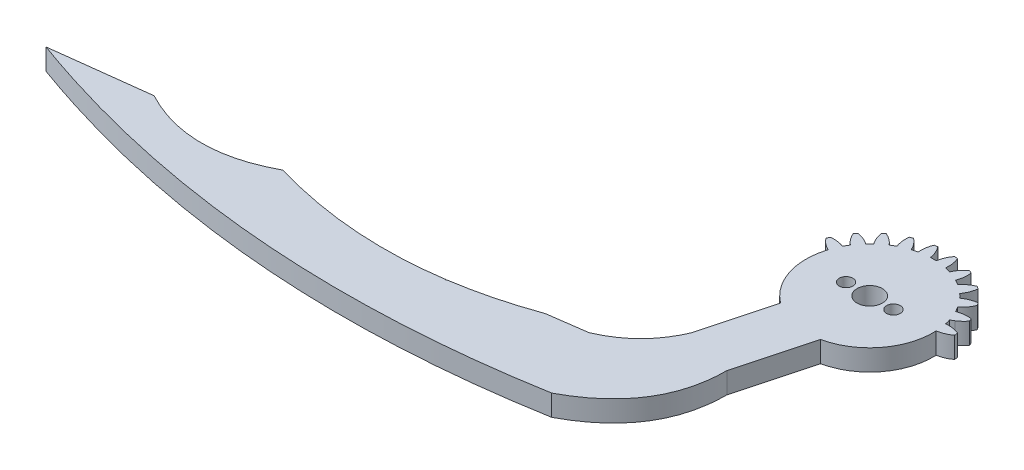
from build123d import *
from build123d.topology import SkipClean

# Parameters (mm, degrees)
SKETCH1_R           = 1.5
BOSS_EXTRUDE1_DEPTH = 4
SKETCH3_R           = 1.75
BOSS_EXTRUDE2_DEPTH = 4
CUT_EXTRUDE1_START  = -4
CUT_EXTRUDE1_DEPTH  = 4
CUT_EXTRUDE2_REACH  = 49.073
SKETCH5_R           = 1.3
SKETCH5_R_2         = 2.4
BOSS_EXTRUDE3_START = -4
BOSS_EXTRUDE3_DEPTH = 4
CUT_EXTRUDE3_START  = -10
SKETCH6_3_R         = 1.75
CUT_EXTRUDE3_DEPTH  = 10


with BuildPart() as part:
    # Sketch1 → Boss-Extrude1 (new body)
    with BuildSketch(Plane(origin=(0, 0, 0), x_dir=(1, 0, 0), z_dir=(0, 1, 0))):
        with BuildLine():
            Line((20.643657446, 4), (2.081641936, 4))
            ThreePointArc((2.081641936, 4), (2.861028333, 4.588201733), (3.521749436, 5.30713988))
            ThreePointArc((3.521749436, 5.30713988), (3.405395609, 5.596745198), (3.282888305, 5.883801663))
            ThreePointArc((3.282888305, 5.883801663), (1.93527598, 5.894040025), (0.627094961, 5.57027124))
            ThreePointArc((0.627094961, 5.57027124), (0.366286148, 6.046375), (0.084372603, 6.510293938))
            ThreePointArc((0.084372603, 6.510293938), (1.018855105, 7.48132754), (1.683794586, 8.65351323))
            ThreePointArc((1.683794586, 8.65351323), (1.496450048, 8.903135899), (1.303821399, 9.148703928))
            ThreePointArc((1.303821399, 9.148703928), (-0.000522033, 8.809805691), (-1.180330337, 8.158486898))
            ThreePointArc((-1.180330337, 8.158486898), (-1.555477026, 8.550865528), (-1.947855656, 8.926012217))
            ThreePointArc((-1.947855656, 8.926012217), (-1.296536862, 10.105820521), (-0.957638625, 11.410163953))
            ThreePointArc((-0.957638625, 11.410163953), (-1.203206655, 11.602792602), (-1.452829324, 11.79013714))
            ThreePointArc((-1.452829324, 11.79013714), (-2.625015014, 11.125197659), (-3.596048616, 10.190715157))
            ThreePointArc((-3.596048616, 10.190715157), (-4.059967554, 10.472628702), (-4.536071314, 10.733437515))
            ThreePointArc((-4.536071314, 10.733437515), (-4.212302529, 12.041618533), (-4.222540891, 13.389230859))
            ThreePointArc((-4.222540891, 13.389230859), (-4.509597355, 13.511738163), (-4.799202674, 13.62809199))
            ThreePointArc((-4.799202674, 13.62809199), (-5.759348103, 12.682425791), (-6.455432668, 11.528463019))
            ThreePointArc((-6.455432668, 11.528463019), (-6.976508546, 11.680699536), (-7.503891752, 11.809396783))
            ThreePointArc((-7.503891752, 11.809396783), (-7.529737283, 13.156800143), (-7.888414517, 14.455843809))
            ThreePointArc((-7.888414517, 14.455843809), (-8.197396993, 14.499881098), (-8.507248835, 14.537314892))
            ThreePointArc((-8.507248835, 14.537314892), (-9.18992168, 13.375367565), (-9.563620196, 12.080565177))
            ThreePointArc((-9.563620196, 12.080565177), (-10.106342554, 12.09275), (-10.649064912, 12.080565177))
            ThreePointArc((-10.649064912, 12.080565177), (-11.022763428, 13.375367565), (-11.705436272, 14.537314892))
            ThreePointArc((-11.705436272, 14.537314892), (-12.015288115, 14.499881098), (-12.324270591, 14.455843809))
            ThreePointArc((-12.324270591, 14.455843809), (-12.682947825, 13.156800143), (-12.708793355, 11.809396783))
            ThreePointArc((-12.708793355, 11.809396783), (-13.236176561, 11.680699536), (-13.757252439, 11.528463019))
            ThreePointArc((-13.757252439, 11.528463019), (-14.453337005, 12.682425791), (-15.413482434, 13.62809199))
            ThreePointArc((-15.413482434, 13.62809199), (-15.703087752, 13.511738163), (-15.990144217, 13.389230859))
            ThreePointArc((-15.990144217, 13.389230859), (-16.000382579, 12.041618533), (-15.676613793, 10.733437515))
            ThreePointArc((-15.676613793, 10.733437515), (-16.152717554, 10.472628702), (-16.616636492, 10.190715157))
            ThreePointArc((-16.616636492, 10.190715157), (-17.587670094, 11.125197659), (-18.759855783, 11.79013714))
            ThreePointArc((-18.759855783, 11.79013714), (-19.009478453, 11.602792602), (-19.255046482, 11.410163953))
            ThreePointArc((-19.255046482, 11.410163953), (-18.916148245, 10.105820521), (-18.264829452, 8.926012217))
            ThreePointArc((-18.264829452, 8.926012217), (-18.657208082, 8.550865528), (-19.032354771, 8.158486898))
            ThreePointArc((-19.032354771, 8.158486898), (-20.212163074, 8.809805691), (-21.516506507, 9.148703928))
            ThreePointArc((-21.516506507, 9.148703928), (-21.709135156, 8.903135899), (-21.896479694, 8.65351323))
            ThreePointArc((-21.896479694, 8.65351323), (-21.231540213, 7.48132754), (-20.297057711, 6.510293938))
            ThreePointArc((-20.297057711, 6.510293938), (-20.578971255, 6.046375), (-20.839780068, 5.57027124))
            ThreePointArc((-20.839780068, 5.57027124), (-22.147961087, 5.894040025), (-23.495573413, 5.883801663))
            ThreePointArc((-23.495573413, 5.883801663), (-23.618080717, 5.596745198), (-23.734434544, 5.30713988))
            ThreePointArc((-23.734434544, 5.30713988), (-22.788768345, 4.346994451), (-21.634805572, 3.650909885))
            ThreePointArc((-21.634805572, 3.650909885), (-21.78704209, 3.129834008), (-21.915739337, 2.602450802))
            ThreePointArc((-21.915739337, 2.602450802), (-23.263142697, 2.576605271), (-24.562186363, 2.217928037))
            ThreePointArc((-24.562186363, 2.217928037), (-24.606223651, 1.908945561), (-24.643657446, 1.599093719))
            ThreePointArc((-24.643657446, 1.599093719), (-23.481710119, 0.916420874), (-22.186907731, 0.542722358))
            ThreePointArc((-22.186907731, 0.542722358), (-22.199092554, 0), (-22.186907731, -0.542722358))
            ThreePointArc((-22.186907731, -0.542722358), (-23.481710119, -0.916420874), (-24.643657446, -1.599093719))
            ThreePointArc((-24.643657446, -1.599093719), (-24.606223651, -1.908945561), (-24.562186363, -2.217928037))
            ThreePointArc((-24.562186363, -2.217928037), (-23.263142697, -2.576605271), (-21.915739337, -2.602450802))
            ThreePointArc((-21.915739337, -2.602450802), (-21.78704209, -3.129834008), (-21.634805572, -3.650909885))
            ThreePointArc((-21.634805572, -3.650909885), (-22.788768345, -4.346994451), (-23.734434544, -5.30713988))
            ThreePointArc((-23.734434544, -5.30713988), (-23.618080717, -5.596745198), (-23.495573413, -5.883801663))
            ThreePointArc((-23.495573413, -5.883801663), (-22.147961087, -5.894040025), (-20.839780068, -5.57027124))
            ThreePointArc((-20.839780068, -5.57027124), (-20.578971255, -6.046375), (-20.297057711, -6.510293938))
            ThreePointArc((-20.297057711, -6.510293938), (-21.231540213, -7.48132754), (-21.896479694, -8.65351323))
            ThreePointArc((-21.896479694, -8.65351323), (-21.709135156, -8.903135899), (-21.516506507, -9.148703928))
            ThreePointArc((-21.516506507, -9.148703928), (-20.212163074, -8.809805691), (-19.032354771, -8.158486898))
            ThreePointArc((-19.032354771, -8.158486898), (-18.657208082, -8.550865528), (-18.264829452, -8.926012217))
            ThreePointArc((-18.264829452, -8.926012217), (-18.916148245, -10.105820521), (-19.255046482, -11.410163953))
            ThreePointArc((-19.255046482, -11.410163953), (-19.009478453, -11.602792602), (-18.759855783, -11.79013714))
            ThreePointArc((-18.759855783, -11.79013714), (-17.587670094, -11.125197659), (-16.616636492, -10.190715157))
            ThreePointArc((-16.616636492, -10.190715157), (-16.152717554, -10.472628702), (-15.676613793, -10.733437515))
            ThreePointArc((-15.676613793, -10.733437515), (-16.000382579, -12.041618533), (-15.990144217, -13.389230859))
            ThreePointArc((-15.990144217, -13.389230859), (-15.703087752, -13.511738163), (-15.413482434, -13.62809199))
            ThreePointArc((-15.413482434, -13.62809199), (-14.453337005, -12.682425791), (-13.757252439, -11.528463019))
            ThreePointArc((-13.757252439, -11.528463019), (-13.236176561, -11.680699536), (-12.708793355, -11.809396783))
            ThreePointArc((-12.708793355, -11.809396783), (-12.682947825, -13.156800143), (-12.324270591, -14.455843809))
            ThreePointArc((-12.324270591, -14.455843809), (-12.015288115, -14.499881098), (-11.705436272, -14.537314892))
            ThreePointArc((-11.705436272, -14.537314892), (-11.022763428, -13.375367565), (-10.649064912, -12.080565177))
            ThreePointArc((-10.649064912, -12.080565177), (-10.106342554, -12.09275), (-9.563620196, -12.080565177))
            ThreePointArc((-9.563620196, -12.080565177), (-9.18992168, -13.375367565), (-8.507248835, -14.537314892))
            ThreePointArc((-8.507248835, -14.537314892), (-8.197396993, -14.499881098), (-7.888414517, -14.455843809))
            ThreePointArc((-7.888414517, -14.455843809), (-7.529737283, -13.156800143), (-7.503891752, -11.809396783))
            ThreePointArc((-7.503891752, -11.809396783), (-6.976508546, -11.680699536), (-6.455432668, -11.528463019))
            ThreePointArc((-6.455432668, -11.528463019), (-5.759348103, -12.682425791), (-4.799202674, -13.62809199))
            ThreePointArc((-4.799202674, -13.62809199), (-4.509597355, -13.511738163), (-4.222540891, -13.389230859))
            ThreePointArc((-4.222540891, -13.389230859), (-4.212302529, -12.041618533), (-4.536071314, -10.733437515))
            ThreePointArc((-4.536071314, -10.733437515), (-4.059967554, -10.472628702), (-3.596048616, -10.190715157))
            ThreePointArc((-3.596048616, -10.190715157), (-2.625015014, -11.125197659), (-1.452829324, -11.79013714))
            ThreePointArc((-1.452829324, -11.79013714), (-1.203206655, -11.602792602), (-0.957638625, -11.410163953))
            ThreePointArc((-0.957638625, -11.410163953), (-1.296536862, -10.105820521), (-1.947855656, -8.926012217))
            ThreePointArc((-1.947855656, -8.926012217), (-1.555477026, -8.550865528), (-1.180330337, -8.158486898))
            ThreePointArc((-1.180330337, -8.158486898), (-0.000522033, -8.809805691), (1.303821399, -9.148703928))
            ThreePointArc((1.303821399, -9.148703928), (1.496450048, -8.903135899), (1.683794586, -8.65351323))
            ThreePointArc((1.683794586, -8.65351323), (1.018855105, -7.48132754), (0.084372603, -6.510293938))
            ThreePointArc((0.084372603, -6.510293938), (0.366286148, -6.046375), (0.627094961, -5.57027124))
            ThreePointArc((0.627094961, -5.57027124), (1.93527598, -5.894040025), (3.282888305, -5.883801663))
            ThreePointArc((3.282888305, -5.883801663), (3.405395609, -5.596745198), (3.521749436, -5.30713988))
            ThreePointArc((3.521749436, -5.30713988), (2.861028333, -4.588201733), (2.081641936, -4))
            Line((2.081641936, -4), (20.643657446, -4))
            ThreePointArc((20.643657446, -4), (24.643657446, 0), (20.643657446, 4))
        make_face()
        with Locations(Location((-10.106342554, 0, 0), (0, 0, 270))):
            Circle(SKETCH1_R, mode=Mode.SUBTRACT)
        with Locations(Location((20.643657446, 0, 0), (0, 0, 270))):
            Circle(SKETCH1_R, mode=Mode.SUBTRACT)
    extrude(amount=BOSS_EXTRUDE1_DEPTH)

    # Sketch3 → Boss-Extrude2 (add)
    with BuildSketch(Plane(origin=(0, 4, 0), x_dir=(1, 0, 0), z_dir=(0, 1, 0))):
        with BuildLine():
            ThreePointArc((-9.584237785, -3.965779445), (-14.072121999, -0.522104769), (-10.628447323, 3.965779445))
            Line((-10.628447323, 3.965779445), (-41.11537681, -0.047900965))
            ThreePointArc((-41.11537681, -0.047900965), (-44.559051487, -4.53578518), (-40.071167272, -7.979459856))
            Line((-40.071167272, -7.979459856), (-9.584237785, -3.965779445))
        make_face()
        with Locations(Location((-40.593272041, -4.013680411, 0), (0, 0, 270))):
            Circle(SKETCH3_R, mode=Mode.SUBTRACT)
    extrude(amount=-BOSS_EXTRUDE2_DEPTH)

    # Sketch4 → Cut-Extrude1 (cut)
    with SkipClean():  # the faces are left unmerged after this step: merging them gives an invalid solid
        with BuildSketch(Plane(origin=(0, 4, 0), x_dir=(1, 0, 0), z_dir=(0, 1, 0)).offset(CUT_EXTRUDE1_START)):
            with BuildLine():
                ThreePointArc((20.643657446, -4), (24.643657446, 0), (20.643657446, 4))
                Line((20.643657446, 4), (2.081641936, 4))
                Line((2.081641936, 4), (1.43808022, 3.600125745))
                ThreePointArc((1.43808022, 3.600125745), (1.581217534, 3.104116905), (1.70305423, 2.602450802))
                ThreePointArc((1.70305423, 2.602450802), (3.050457589, 2.576605271), (4.349501255, 2.217928037))
                ThreePointArc((4.349501255, 2.217928037), (4.393538544, 1.908945561), (4.430972339, 1.599093719))
                ThreePointArc((4.430972339, 1.599093719), (3.269025011, 0.916420874), (1.974222624, 0.542722358))
                ThreePointArc((1.974222624, 0.542722358), (1.70305423, -2.602450802), (0.627094961, -5.57027124))
                ThreePointArc((0.627094961, -5.57027124), (1.93527598, -5.894040025), (3.282888305, -5.883801663))
                ThreePointArc((3.282888305, -5.883801663), (3.405395609, -5.596745198), (3.521749436, -5.30713988))
                ThreePointArc((3.521749436, -5.30713988), (2.861028333, -4.588201733), (2.081641936, -4))
                Line((2.081641936, -4), (20.643657446, -4))
            make_face()
            with BuildLine():
                ThreePointArc((1.683794586, -8.65351323), (1.018855105, -7.48132754), (0.084372603, -6.510293938))
                ThreePointArc((0.084372603, -6.510293938), (-0.512518948, -7.361599771), (-1.180330337, -8.158486898))
                ThreePointArc((-1.180330337, -8.158486898), (-0.000522033, -8.809805691), (1.303821399, -9.148703928))
                ThreePointArc((1.303821399, -9.148703928), (1.496450048, -8.903135899), (1.683794586, -8.65351323))
            make_face()
            with BuildLine():
                ThreePointArc((-0.957638625, -11.410163953), (-1.296536862, -10.105820521), (-1.947855656, -8.926012217))
                ThreePointArc((-1.947855656, -8.926012217), (-2.744742783, -9.593823606), (-3.596048616, -10.190715157))
                ThreePointArc((-3.596048616, -10.190715157), (-2.625015014, -11.125197659), (-1.452829324, -11.79013714))
                ThreePointArc((-1.452829324, -11.79013714), (-1.203206655, -11.602792602), (-0.957638625, -11.410163953))
            make_face()
            with BuildLine():
                ThreePointArc((-4.222540891, -13.389230859), (-4.212302529, -12.041618533), (-4.536071314, -10.733437515))
                ThreePointArc((-4.536071314, -10.733437515), (-5.478647477, -11.172244217), (-6.455432668, -11.528463019))
                ThreePointArc((-6.455432668, -11.528463019), (-5.759348103, -12.682425791), (-4.799202674, -13.62809199))
                ThreePointArc((-4.799202674, -13.62809199), (-4.509597355, -13.511738163), (-4.222540891, -13.389230859))
            make_face()
            with BuildLine():
                ThreePointArc((-7.888414517, -14.455843809), (-7.529737283, -13.156800143), (-7.503891752, -11.809396783))
                ThreePointArc((-7.503891752, -11.809396783), (-8.527921943, -11.989294847), (-9.563620196, -12.080565177))
                ThreePointArc((-9.563620196, -12.080565177), (-9.18992168, -13.375367565), (-8.507248835, -14.537314892))
                ThreePointArc((-8.507248835, -14.537314892), (-8.197396993, -14.499881098), (-7.888414517, -14.455843809))
            make_face()
            with BuildLine():
                ThreePointArc((-11.705436272, -14.537314892), (-11.022763428, -13.375367565), (-10.649064912, -12.080565177))
                ThreePointArc((-10.649064912, -12.080565177), (-11.684763165, -11.989294847), (-12.708793355, -11.809396783))
                ThreePointArc((-12.708793355, -11.809396783), (-12.682947825, -13.156800143), (-12.324270591, -14.455843809))
                ThreePointArc((-12.324270591, -14.455843809), (-12.015288115, -14.499881098), (-11.705436272, -14.537314892))
            make_face()
            with BuildLine():
                ThreePointArc((-15.413482434, -13.62809199), (-14.453337005, -12.682425791), (-13.757252439, -11.528463019))
                ThreePointArc((-13.757252439, -11.528463019), (-14.734037631, -11.172244217), (-15.676613793, -10.733437515))
                ThreePointArc((-15.676613793, -10.733437515), (-16.000382579, -12.041618533), (-15.990144217, -13.389230859))
                ThreePointArc((-15.990144217, -13.389230859), (-15.703087752, -13.511738163), (-15.413482434, -13.62809199))
            make_face()
            with BuildLine():
                ThreePointArc((-18.759855783, -11.79013714), (-17.587670094, -11.125197659), (-16.616636492, -10.190715157))
                ThreePointArc((-16.616636492, -10.190715157), (-17.467942324, -9.593823606), (-18.264829452, -8.926012217))
                ThreePointArc((-18.264829452, -8.926012217), (-18.916148245, -10.105820521), (-19.255046482, -11.410163953))
                ThreePointArc((-19.255046482, -11.410163953), (-19.009478453, -11.602792602), (-18.759855783, -11.79013714))
            make_face()
            with BuildLine():
                ThreePointArc((-21.516506507, -9.148703928), (-20.212163074, -8.809805691), (-19.032354771, -8.158486898))
                ThreePointArc((-19.032354771, -8.158486898), (-19.70016616, -7.361599771), (-20.297057711, -6.510293938))
                ThreePointArc((-20.297057711, -6.510293938), (-21.231540213, -7.48132754), (-21.896479694, -8.65351323))
                ThreePointArc((-21.896479694, -8.65351323), (-21.709135156, -8.903135899), (-21.516506507, -9.148703928))
            make_face()
            with BuildLine():
                ThreePointArc((-21.942853375, 2.47620963), (-21.92946485, 2.539366405), (-21.915739337, 2.602450802))
                ThreePointArc((-21.915739337, 2.602450802), (-23.263142697, 2.576605271), (-24.562186363, 2.217928037))
                ThreePointArc((-24.562186363, 2.217928037), (-24.56889027, 2.173784387), (-24.575459377, 2.129620475))
                Line((-24.575459377, 2.129620475), (-21.942853375, 2.47620963))
            make_face()
            with BuildLine():
                ThreePointArc((-23.495573413, -5.883801663), (-22.147961087, -5.894040025), (-20.839780068, -5.57027124))
                ThreePointArc((-20.839780068, -5.57027124), (-20.869365339, -5.512888815), (-20.898643838, -5.455349261))
                Line((-20.898643838, -5.455349261), (-23.531249839, -5.801938416))
                ThreePointArc((-23.531249839, -5.801938416), (-23.513474108, -5.842897269), (-23.495573413, -5.883801663))
            make_face()
        extrude(amount=CUT_EXTRUDE1_DEPTH, mode=Mode.SUBTRACT)

    # Sketch5 → Cut-Extrude2 (cut, up to next)
    with BuildSketch(Plane(origin=(0, 4, 0), x_dir=(1, 0, 0), z_dir=(0, 1, 0)), mode=Mode.PRIVATE) as cut_extrude2_sk1:
        with Locations(Location((-14.606342554, 0, 0), (0, 0, 270))):
            Circle(SKETCH5_R)
    cut_extrude2_tool1 = extrude(cut_extrude2_sk1.sketch, amount=-CUT_EXTRUDE2_REACH, mode=Mode.PRIVATE) & part.part
    # Sketch5 → Cut-Extrude2 (cut, up to next)
    with BuildSketch(Plane(origin=(0, 4, 0), x_dir=(1, 0, 0), z_dir=(0, 1, 0)), mode=Mode.PRIVATE) as cut_extrude2_sk2:
        with Locations(Location((-5.606342554, 0, 0), (0, 0, 270))):
            Circle(SKETCH5_R)
    cut_extrude2_tool2 = extrude(cut_extrude2_sk2.sketch, amount=-CUT_EXTRUDE2_REACH, mode=Mode.PRIVATE) & part.part
    # Sketch5 → Cut-Extrude2 (cut, up to next)
    with BuildSketch(Plane(origin=(0, 4, 0), x_dir=(1, 0, 0), z_dir=(0, 1, 0)), mode=Mode.PRIVATE) as cut_extrude2_sk3:
        with Locations(Location((-10.106342554, 0, 0), (0, 0, 270))):
            Circle(SKETCH5_R_2)
    cut_extrude2_tool3 = extrude(cut_extrude2_sk3.sketch, amount=-CUT_EXTRUDE2_REACH, mode=Mode.PRIVATE) & part.part
    add(cut_extrude2_tool1.solids().sort_by_distance((-14.606343, 4, 0))[0], mode=Mode.SUBTRACT)
    add(cut_extrude2_tool2.solids().sort_by_distance((-5.606343, 4, 0))[0], mode=Mode.SUBTRACT)
    add(cut_extrude2_tool3.solids().sort_by_distance((-10.106343, 4, 0))[0], mode=Mode.SUBTRACT)

    # Sketch6 → Boss-Extrude3 (add)
    with SkipClean():  # the faces are left unmerged after this step: merging them gives an invalid solid
        with BuildSketch(Plane(origin=(0, 4, 0), x_dir=(1, 0, 0), z_dir=(0, 1, 0)).offset(BOSS_EXTRUDE3_START)):
            with BuildLine():
                ThreePointArc((-52.962051912, -37.720188973), (-53.029457116, -37.643685191), (-53.094890456, -37.565488207))
                add(Edge.make_bspline(
                    [(-53.094890456, -37.565488207), (-69.574492007, -40.022931453), (-86.473755851, -35.03783058)],
                    knots=[0.398617796, 0.398617796, 0.398617796, 1, 1, 1], degree=2))
                add(Edge.make_bspline(
                    [(-86.473755851, -35.03783058), (-98.679286779, -41.59959414), (-110.954647006, -35.03783058)],
                    knots=[0, 0, 0, 1, 1, 1], degree=2))
                Line((-110.954647006, -35.03783058), (-129.244737731, -37.275679444))
                add(Edge.make_bspline(
                    [(-24.307799862, -46.178856242), (-78.550492212, -55.693347591), (-129.244737731, -37.275679444)],
                    knots=[0.002349817, 0.002349817, 0.002349817, 1, 1, 1], degree=2))
                add(Edge.make_bspline(
                    [(-24.307799862, -46.178856242), (-11.325946224, -39.297851738), (-11.379295158, -25.85254802)],
                    knots=[0, 0, 0, 1, 1, 1], degree=2))
                Line((-11.379295158, -25.85254802), (-10.692878437, -23.290805939))
                Line((-10.692878437, -23.290805939), (-7.62332727, -11.83508503))
                ThreePointArc((-7.62332727, -11.83508503), (-7.874404331, -11.88499282), (-8.126481564, -11.929574721))
                ThreePointArc((-8.126481564, -11.929574721), (-12.992916327, -11.743180762), (-17.391194669, -9.652229391))
                Line((-17.391194669, -9.652229391), (-20.453641162, -21.0814353))
                Line((-20.453641162, -21.0814353), (-20.986801846, -23.071218061))
                add(Edge.make_bspline(
                    [(-30.706376797, -32.703441208), (-23.88923072, -29.810908187), (-20.986801846, -23.071218061)],
                    knots=[0, 0, 0, 1, 1, 1], degree=2))
                Line((-30.706376797, -32.703441208), (-31.121289752, -32.76140473))
                Line((-31.121289752, -32.76140473), (-38.003060246, -33.722791093))
                add(Edge.make_bspline(
                    [(-38.003060246, -33.722791093), (-45.394684007, -36.393930701), (-52.872751681, -37.532021826)],
                    knots=[0.121623856, 0.121623856, 0.121623856, 0.394564246, 0.394564246, 0.394564246], degree=2))
                ThreePointArc((-52.872751681, -37.532021826), (-52.918626749, -37.625524062), (-52.962051912, -37.720188973))
            make_face()
        extrude(amount=BOSS_EXTRUDE3_DEPTH)

    # Sketch6<3> → Cut-Extrude3 (cut)
    with SkipClean():  # the faces are left unmerged after this step: merging them gives an invalid solid
        with BuildSketch(Plane(origin=(0, 4, 0), x_dir=(1, 0, 0), z_dir=(0, 1, 0)).offset(CUT_EXTRUDE3_START)):
            with BuildLine():
                Line((-40.071167272, -7.979459856), (-20.898643838, -5.455349261))
                ThreePointArc((-20.898643838, -5.455349261), (-22.095637401, -1.578420611), (-21.942853375, 2.47620963))
                Line((-21.942853375, 2.47620963), (-41.11537681, -0.047900965))
                ThreePointArc((-41.11537681, -0.047900965), (-44.592679619, -4.082521016), (-40.978584416, -7.995078956))
                ThreePointArc((-40.978584416, -7.995078956), (-40.524431436, -8.013087988), (-40.071167272, -7.979459856))
            make_face()
            with Locations((-40.593272041, -4.013680411)):
                Circle(SKETCH6_3_R, mode=Mode.SUBTRACT)
        extrude(amount=CUT_EXTRUDE3_DEPTH, mode=Mode.SUBTRACT)


solid = part.part
